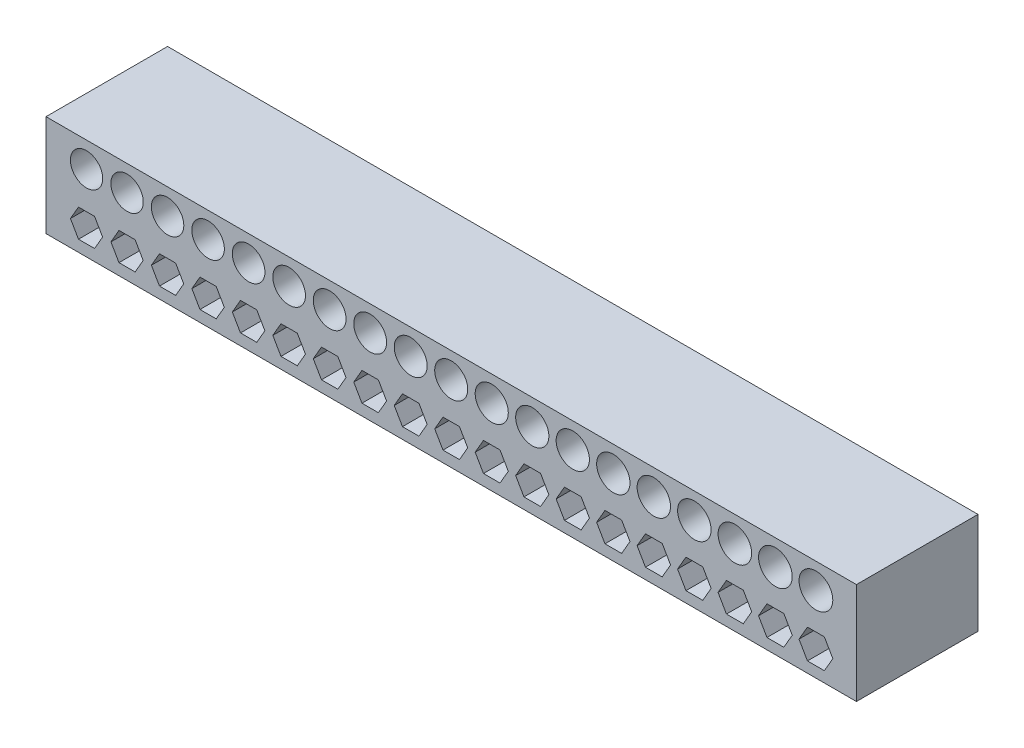
from build123d import *

# Parameters (mm, degrees)
SKETCH1_W           = 200
SKETCH1_H           = 25
SKETCH1_R           = 4.075
SKETCH1_R_2         = 3.985
SKETCH1_R_3         = 3.995
SKETCH1_R_4         = 4.005
SKETCH1_R_5         = 4.015
SKETCH1_R_6         = 4.025
SKETCH1_R_7         = 4.035
SKETCH1_R_8         = 4.045
SKETCH1_R_9         = 4.055
SKETCH1_R_10        = 4.065
SKETCH1_R_11        = 4.135
SKETCH1_R_12        = 4.145
SKETCH1_R_13        = 4.155
SKETCH1_R_14        = 4.165
SKETCH1_R_15        = 4.085
SKETCH1_R_16        = 4.095
SKETCH1_R_17        = 4.105
SKETCH1_R_18        = 4.115
SKETCH1_R_19        = 4.125
BOSS_EXTRUDE1_DEPTH = 30


with BuildPart() as part:
    # Sketch1 → Boss-Extrude1 (new body)
    with BuildSketch(Plane.XY):
        Rectangle(SKETCH1_W, SKETCH1_H)
        with Locations((0, 6.25)):
            Circle(SKETCH1_R, mode=Mode.SUBTRACT)
        Polygon((-2.036084392, -2.723398385), (2.036084392, -2.723398385), (4.072168784, -6.25), (2.036084392, -9.776601615), (-2.036084392, -9.776601615), (-4.072168784, -6.25), align=None, mode=Mode.SUBTRACT)
        Polygon((-93.968245735, -6.25), (-91.984122868, -2.813398385), (-88.015877132, -2.813398385), (-86.031754265, -6.25), (-88.015877132, -9.686601615), (-91.984122868, -9.686601615), align=None, mode=Mode.SUBTRACT)
        Polygon((-83.979792741, -6.25), (-81.98989637, -2.803398385), (-78.01010363, -2.803398385), (-76.020207259, -6.25), (-78.01010363, -9.696601615), (-81.98989637, -9.696601615), align=None, mode=Mode.SUBTRACT)
        Polygon((-73.991339746, -6.25), (-71.995669873, -2.793398385), (-68.004330127, -2.793398385), (-66.008660254, -6.25), (-68.004330127, -9.706601615), (-71.995669873, -9.706601615), align=None, mode=Mode.SUBTRACT)
        Polygon((-64.002886751, -6.25), (-62.001443376, -2.783398385), (-57.998556624, -2.783398385), (-55.997113249, -6.25), (-57.998556624, -9.716601615), (-62.001443376, -9.716601615), align=None, mode=Mode.SUBTRACT)
        Polygon((-54.014433757, -6.25), (-52.007216878, -2.773398385), (-47.992783122, -2.773398385), (-45.985566243, -6.25), (-47.992783122, -9.726601615), (-52.007216878, -9.726601615), align=None, mode=Mode.SUBTRACT)
        Polygon((-44.025980762, -6.25), (-42.012990381, -2.763398385), (-37.987009619, -2.763398385), (-35.974019238, -6.25), (-37.987009619, -9.736601615), (-42.012990381, -9.736601615), align=None, mode=Mode.SUBTRACT)
        Polygon((-34.037527767, -6.25), (-32.018763884, -2.753398385), (-27.981236116, -2.753398385), (-25.962472233, -6.25), (-27.981236116, -9.746601615), (-32.018763884, -9.746601615), align=None, mode=Mode.SUBTRACT)
        Polygon((-24.049074773, -6.25), (-22.024537386, -2.743398385), (-17.975462614, -2.743398385), (-15.950925227, -6.25), (-17.975462614, -9.756601615), (-22.024537386, -9.756601615), align=None, mode=Mode.SUBTRACT)
        Polygon((-14.060621778, -6.25), (-12.030310889, -2.733398385), (-7.969689111, -2.733398385), (-5.939378222, -6.25), (-7.969689111, -9.766601615), (-12.030310889, -9.766601615), align=None, mode=Mode.SUBTRACT)
        with Locations((-90, 6.25)):
            Circle(SKETCH1_R_2, mode=Mode.SUBTRACT)
        with Locations((-80, 6.25)):
            Circle(SKETCH1_R_3, mode=Mode.SUBTRACT)
        with Locations((-70, 6.25)):
            Circle(SKETCH1_R_4, mode=Mode.SUBTRACT)
        with Locations((-60, 6.25)):
            Circle(SKETCH1_R_5, mode=Mode.SUBTRACT)
        with Locations((-50, 6.25)):
            Circle(SKETCH1_R_6, mode=Mode.SUBTRACT)
        with Locations((-40, 6.25)):
            Circle(SKETCH1_R_7, mode=Mode.SUBTRACT)
        with Locations((-30, 6.25)):
            Circle(SKETCH1_R_8, mode=Mode.SUBTRACT)
        with Locations((-20, 6.25)):
            Circle(SKETCH1_R_9, mode=Mode.SUBTRACT)
        with Locations((-10, 6.25)):
            Circle(SKETCH1_R_10, mode=Mode.SUBTRACT)
        with Locations((60, 6.25)):
            Circle(SKETCH1_R_11, mode=Mode.SUBTRACT)
        with Locations((70, 6.25)):
            Circle(SKETCH1_R_12, mode=Mode.SUBTRACT)
        with Locations((80, 6.25)):
            Circle(SKETCH1_R_13, mode=Mode.SUBTRACT)
        with Locations((90, 6.25)):
            Circle(SKETCH1_R_14, mode=Mode.SUBTRACT)
        Polygon((5.916284211, -6.25), (7.958142105, -2.713398385), (12.041857895, -2.713398385), (14.083715789, -6.25), (12.041857895, -9.786601615), (7.958142105, -9.786601615), align=None, mode=Mode.SUBTRACT)
        Polygon((15.904737206, -6.25), (17.952368603, -2.703398385), (22.047631397, -2.703398385), (24.095262794, -6.25), (22.047631397, -9.796601615), (17.952368603, -9.796601615), align=None, mode=Mode.SUBTRACT)
        Polygon((25.8931902, -6.25), (27.9465951, -2.693398385), (32.0534049, -2.693398385), (34.1068098, -6.25), (32.0534049, -9.806601615), (27.9465951, -9.806601615), align=None, mode=Mode.SUBTRACT)
        Polygon((35.881643195, -6.25), (37.940821597, -2.683398385), (42.059178403, -2.683398385), (44.118356805, -6.25), (42.059178403, -9.816601615), (37.940821597, -9.816601615), align=None, mode=Mode.SUBTRACT)
        Polygon((45.870096189, -6.25), (47.935048095, -2.673398385), (52.064951905, -2.673398385), (54.129903811, -6.25), (52.064951905, -9.826601615), (47.935048095, -9.826601615), align=None, mode=Mode.SUBTRACT)
        Polygon((55.858549184, -6.25), (57.929274592, -2.663398385), (62.070725408, -2.663398385), (64.141450816, -6.25), (62.070725408, -9.836601615), (57.929274592, -9.836601615), align=None, mode=Mode.SUBTRACT)
        Polygon((65.847002179, -6.25), (67.923501089, -2.653398385), (72.076498911, -2.653398385), (74.152997821, -6.25), (72.076498911, -9.846601615), (67.923501089, -9.846601615), align=None, mode=Mode.SUBTRACT)
        Polygon((75.835455173, -6.25), (77.917727587, -2.643398385), (82.082272413, -2.643398385), (84.164544827, -6.25), (82.082272413, -9.856601615), (77.917727587, -9.856601615), align=None, mode=Mode.SUBTRACT)
        Polygon((85.823908168, -6.25), (87.911954084, -2.633398385), (92.088045916, -2.633398385), (94.176091832, -6.25), (92.088045916, -9.866601615), (87.911954084, -9.866601615), align=None, mode=Mode.SUBTRACT)
        with Locations((10, 6.25)):
            Circle(SKETCH1_R_15, mode=Mode.SUBTRACT)
        with Locations((20, 6.25)):
            Circle(SKETCH1_R_16, mode=Mode.SUBTRACT)
        with Locations((30, 6.25)):
            Circle(SKETCH1_R_17, mode=Mode.SUBTRACT)
        with Locations((40, 6.25)):
            Circle(SKETCH1_R_18, mode=Mode.SUBTRACT)
        with Locations((50, 6.25)):
            Circle(SKETCH1_R_19, mode=Mode.SUBTRACT)
    extrude(amount=-BOSS_EXTRUDE1_DEPTH)


solid = part.part
